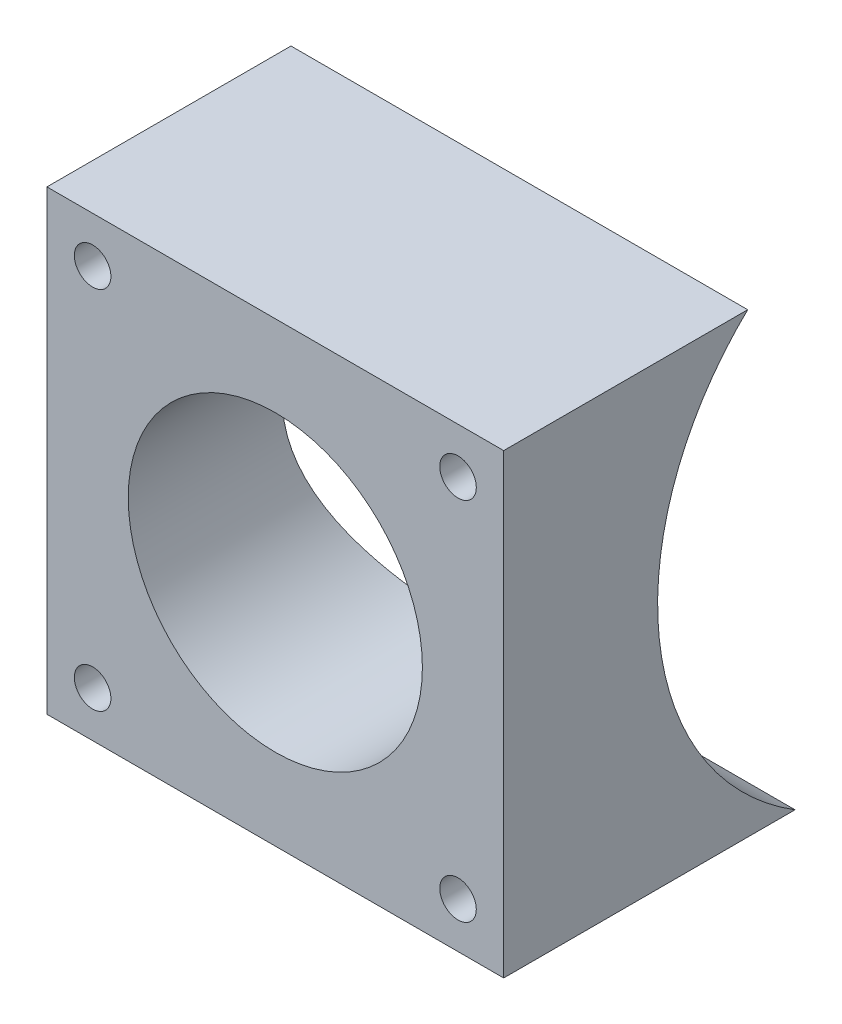
from build123d import *

# Parameters (mm, degrees)
SKETCH1_W               = 50
SKETCH1_H               = 50
SKETCH1_R               = 16.1
SKETCH1_R_2             = 2
BOSS_EXTRUDE1_DEPTH     = 48.6
CUT_EXTRUDE1_DEPTH      = 61.958674526
CUT_EXTRUDE1_DEPTH_BACK = 61.958674526
SKETCH2_R               = 31.75


with BuildPart() as part:
    # Sketch1 → Boss-Extrude1 (new body)
    with BuildSketch(Plane.XY):
        with Locations((0, -2)):
            Rectangle(SKETCH1_W, SKETCH1_H)
        with Locations((0, -2)):
            Circle(SKETCH1_R, mode=Mode.SUBTRACT)
        with Locations((-20, 18)):
            Circle(SKETCH1_R_2, mode=Mode.SUBTRACT)
        with Locations((20, 18)):
            Circle(SKETCH1_R_2, mode=Mode.SUBTRACT)
        with Locations((20, -22)):
            Circle(SKETCH1_R_2, mode=Mode.SUBTRACT)
        with Locations((-20, -22)):
            Circle(SKETCH1_R_2, mode=Mode.SUBTRACT)
    extrude(amount=BOSS_EXTRUDE1_DEPTH)

    # Sketch2 → Cut-Extrude1 (cut, two sides: drawn at the far end of the back side and taken through both)
    with BuildSketch(Plane(origin=(0, 0, 0), x_dir=(0, 0, -1), z_dir=(1, 0, 0)).offset(-CUT_EXTRUDE1_DEPTH_BACK)):
        Circle(SKETCH2_R)
    extrude(amount=CUT_EXTRUDE1_DEPTH + CUT_EXTRUDE1_DEPTH_BACK, mode=Mode.SUBTRACT)


solid = part.part
